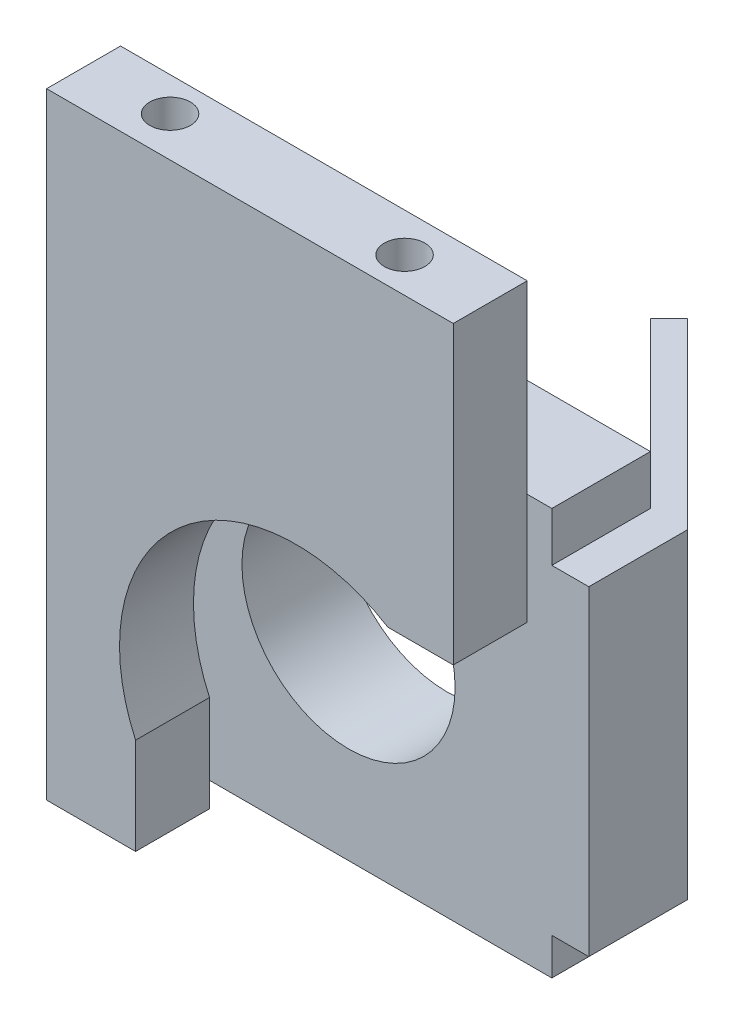
from build123d import *

# Parameters (mm, degrees)
SKETCH2_W           = 33
SKETCH2_H           = 33
SKETCH2_R           = 8.65
BOSS_EXTRUDE1_DEPTH = 8
SKETCH3_W           = 8
SKETCH3_H           = 26
BOSS_EXTRUDE2_DEPTH = 3
SKETCH4_W           = 26
SKETCH4_H           = 21
SKETCH4_R           = 8.1
BOSS_EXTRUDE3_DEPTH = 2.12
SKETCH5_R           = 1.5
BOSS_EXTRUDE4_DEPTH = 2
BOSS_EXTRUDE5_DEPTH = 6
SKETCH7_R           = 1.65
CUT_EXTRUDE1_DEPTH  = 10


with BuildPart() as part:
    # Sketch2 → Boss-Extrude1 (new body)
    with BuildSketch(Plane.XY):
        with Locations((16.5, 16.5)):
            Rectangle(SKETCH2_W, SKETCH2_H)
        with Locations((16.5, 16.5)):
            Circle(SKETCH2_R, mode=Mode.SUBTRACT)
    extrude(amount=BOSS_EXTRUDE1_DEPTH)

    # Sketch3 → Boss-Extrude2 (add)
    with BuildSketch(Plane(origin=(33, 0, 0), x_dir=(0, 0, -1), z_dir=(1, 0, 0))):
        with Locations((-4, 16)):
            Rectangle(SKETCH3_W, SKETCH3_H)
    extrude(amount=BOSS_EXTRUDE2_DEPTH)

    # Sketch4 → Boss-Extrude3 (add)
    with BuildSketch(Plane(origin=(16.5, 0, -16.5), x_dir=(0, 1, 0), z_dir=(0.7071067811865438, 0, -0.7071067811865512))):
        with Locations((16, 14.955844123)):
            Rectangle(SKETCH4_W, SKETCH4_H)
        with Locations((16, 14.955844123)):
            Circle(SKETCH4_R, mode=Mode.SUBTRACT)
    extrude(amount=BOSS_EXTRUDE3_DEPTH)

    # Sketch5 → Boss-Extrude4 (add)
    with BuildSketch(Plane.XY.offset(8)):
        with Locations((2.5, 30.5)):
            Circle(SKETCH5_R)
    extrude(amount=BOSS_EXTRUDE4_DEPTH)

    # Sketch6 → Boss-Extrude5 (add)
    with BuildSketch(Plane.XY.offset(10)):
        with BuildLine():
            Line((7.22, 0), (7.22, 7.823187296))
            ThreePointArc((7.22, 7.823187296), (10.728461041, 24.490588089), (27.694109386, 26))
            Line((27.694109386, 26), (33, 26))
            Line((33, 26), (33, 50))
            Line((33, 50), (0, 50))
            Line((0, 50), (0, 0))
            Line((0, 0), (7.22, 0))
        make_face()
    extrude(amount=BOSS_EXTRUDE5_DEPTH)

    # Sketch7 → Cut-Extrude1 (cut)
    with BuildSketch(Plane(origin=(0, 50, 0), x_dir=(1, 0, 0), z_dir=(0, 1, 0))):
        with Locations((6.77, -12.75)):
            Circle(SKETCH7_R)
        with Locations((26.2, -13.15)):
            Circle(SKETCH7_R)
    extrude(amount=-CUT_EXTRUDE1_DEPTH, mode=Mode.SUBTRACT)


solid = part.part
